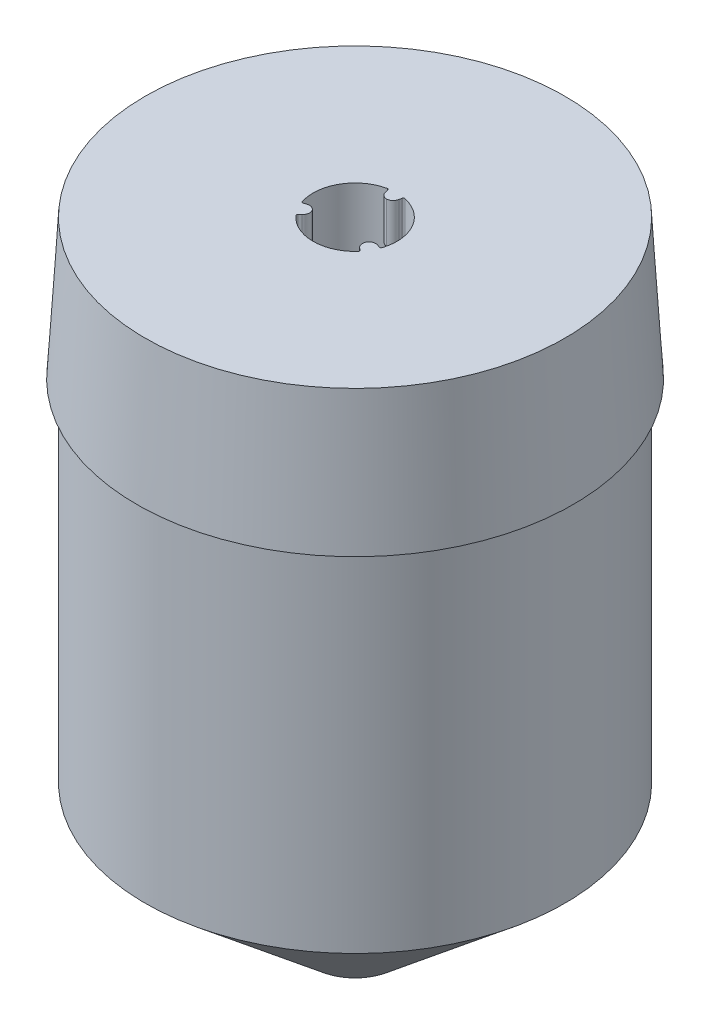
from build123d import *

# Parameters (mm, degrees)
SKETCH1_W           = 8.8
SKETCH1_H           = 32.5
BOSS_EXTRUDE1_START = -3
BOSS_EXTRUDE1_DEPTH = 3
BOSS_EXTRUDE2_START = -3
BOSS_EXTRUDE2_DEPTH = 3
FILLET1_R           = 0.5
FILLET2_R           = 0.1


with BuildPart() as part:
    # Sketch1 → Revolve1 (revolve)
    with BuildSketch(Plane.XY):
        Polygon((-3, 0), (-15, 10), (-15, 35), (-15.6, 35), (-15, 45), (-3, 45), align=None)
        with Locations((-9, 27.15)):
            Rectangle(SKETCH1_W, SKETCH1_H, mode=Mode.SUBTRACT)
    revolve(axis=Axis((0, 21.494459302, 0), (0, -1, 0)))

    # Sketch2 → Boss-Extrude1 (add)
    with BuildSketch(Plane(origin=(0, 45, 0), x_dir=(1, 0, 0), z_dir=(0, 1, 0)).offset(BOSS_EXTRUDE1_START)):
        with BuildLine():
            Line((-0.4, 2.25), (0.4, 2.25))
            Line((0.4, 2.25), (0.525100004, 2.953687523))
            ThreePointArc((0.525100004, 2.953687523), (0, 3), (-0.525100004, 2.953687523))
            Line((-0.525100004, 2.953687523), (-0.4, 2.25))
        make_face()
        with BuildLine():
            Line((2.148557159, -0.778589838), (2.820518432, -1.022093819))
            ThreePointArc((2.820518432, -1.022093819), (2.598076211, -1.5), (2.295418428, -1.931593705))
            Line((2.295418428, -1.931593705), (1.748557159, -1.471410162))
            Line((1.748557159, -1.471410162), (2.148557159, -0.778589838))
        make_face()
        with BuildLine():
            Line((-1.748557159, -1.471410162), (-2.295418428, -1.931593705))
            ThreePointArc((-2.295418428, -1.931593705), (-2.598076211, -1.5), (-2.820518432, -1.022093819))
            Line((-2.820518432, -1.022093819), (-2.148557159, -0.778589838))
            Line((-2.148557159, -0.778589838), (-1.748557159, -1.471410162))
        make_face()
    extrude(amount=BOSS_EXTRUDE1_DEPTH)

    # Sketch3 → Boss-Extrude2 (add)
    with BuildSketch(Plane(origin=(0, 10.9, 0), x_dir=(1, 0, 0), z_dir=(0, 1, 0)).offset(BOSS_EXTRUDE2_START)):
        with BuildLine():
            Line((-0.4, 2.25), (0.4, 2.25))
            Line((0.4, 2.25), (0.525100004, 2.953687523))
            ThreePointArc((0.525100004, 2.953687523), (0, 3), (-0.525100004, 2.953687523))
            Line((-0.525100004, 2.953687523), (-0.4, 2.25))
        make_face()
        with BuildLine():
            Line((-2.295418428, -1.931593705), (-1.748557159, -1.471410162))
            Line((-1.748557159, -1.471410162), (-2.148557159, -0.778589838))
            Line((-2.148557159, -0.778589838), (-2.820518432, -1.022093819))
            ThreePointArc((-2.820518432, -1.022093819), (-2.598076211, -1.5), (-2.295418428, -1.931593705))
        make_face()
        with BuildLine():
            Line((1.748557159, -1.471410162), (2.295418428, -1.931593705))
            ThreePointArc((2.295418428, -1.931593705), (2.598076211, -1.5), (2.820518432, -1.022093819))
            Line((2.820518432, -1.022093819), (2.148557159, -0.778589838))
            Line((2.148557159, -0.778589838), (1.748557159, -1.471410162))
        make_face()
    extrude(amount=BOSS_EXTRUDE2_DEPTH)

    # Fillet1
    # the kernel refuses this fillet: 0.5 mm, written as the material it takes off along each edge
    with BuildSketch(Plane(origin=(-1.748557159, 6.852622791, 1.471410162), x_dir=(-0.765139475997562, 0, 0.6438645682674085), z_dir=(0, 1, 0)), Plane(origin=(2.148557159, 6.852622791, 0.778589838), x_dir=(0.9401728107150568, 0, 0.34069793951849825), z_dir=(0, 1, 0)), Plane(origin=(2.148557159, 40.952622791, 0.778589838), x_dir=(0.9401728107150567, 0, 0.34069793951849836), z_dir=(0, 1, 0)), Plane(origin=(-1.748557159, 40.952622791, 1.471410162), x_dir=(-0.7651394759975623, 0, 0.643864568267408), z_dir=(0, 1, 0)), Plane(origin=(-0.4, 6.852622791, -2.25), x_dir=(-0.17503333471749488, 0, -0.9845625077859066), z_dir=(0, 1, 0)), Plane(origin=(-0.4, 40.952622791, -2.25), x_dir=(-0.17503333471749435, 0, -0.9845625077859067), z_dir=(0, 1, 0))) as fillet1_piece_1:
        with BuildLine():
            CenterArc((FILLET1_R * 0.837901767291, -FILLET1_R), FILLET1_R, 90, 79.919402012)
            Line((-FILLET1_R * 0.146660740495, -FILLET1_R * 0.824966665283), (0, 0))
            Line((0, 0), (FILLET1_R * 0.837901767291, 0))
        make_face()
    extrude(amount=5.094754418, mode=Mode.SUBTRACT)
    with BuildSketch(Plane(origin=(1.748557159, 6.852622791, 1.471410162), x_dir=(0.7651394759975613, 0, 0.6438645682674092), z_dir=(0, 1, 0)), Plane(origin=(-2.148557159, 6.852622791, 0.778589838), x_dir=(-0.9401728107150565, 0, 0.34069793951849886), z_dir=(0, 1, 0)), Plane(origin=(-2.148557159, 40.952622791, 0.778589838), x_dir=(-0.9401728107150564, 0, 0.3406979395184987), z_dir=(0, 1, 0)), Plane(origin=(1.748557159, 40.952622791, 1.471410162), x_dir=(0.7651394759975626, 0, 0.6438645682674077), z_dir=(0, 1, 0)), Plane(origin=(0.4, 6.852622791, -2.25), x_dir=(0.1750333347174944, 0, -0.9845625077859067), z_dir=(0, 1, 0)), Plane(origin=(0.4, 40.952622791, -2.25), x_dir=(0.1750333347174944, 0, -0.9845625077859067), z_dir=(0, 1, 0))) as fillet1_piece_2:
        with BuildLine():
            CenterArc((FILLET1_R * 0.837901767291, FILLET1_R), FILLET1_R, 190.080597988, 79.919402012)
            Line((-FILLET1_R * 0.146660740495, FILLET1_R * 0.824966665283), (0, 0))
            Line((0, 0), (FILLET1_R * 0.837901767291, 0))
        make_face()
    extrude(amount=5.094754418, mode=Mode.SUBTRACT)

    # Fillet2
    fillet2_edges = [part.edges().sort_by_distance(p)[0] for p in [
        (0.525100004, 43.5, -2.953687523),
        (-0.525100004, 43.5, -2.953687523),
        (2.295418428, 43.5, 1.931593705),
        (2.820518432, 43.5, 1.022093819),
        (-2.820518432, 43.5, 1.022093819),
        (-2.295418428, 43.5, 1.931593705),
        (-2.820518432, 9.4, 1.022093819),
        (-2.295418428, 9.4, 1.931593705),
        (2.820518432, 9.4, 1.022093819),
        (2.295418428, 9.4, 1.931593705),
        (0.525100004, 9.4, -2.953687523),
        (-0.525100004, 9.4, -2.953687523),
        (0, 42, -3),
        (-0.499215187, 42, -2.808085428),
        (-0.30937995, 42, -2.372907354),
        (0.30937995, 42, -2.372907354),
        (0.499215187, 42, -2.808085428),
        (2.182265723, 42, 1.836375748),
        (2.598076211, 42, 1.5),
        (2.68148091, 42, 0.97170968),
        (2.209688024, 42, 0.918522781),
        (1.900308074, 42, 1.454384573),
        (-2.598076211, 42, 1.5),
        (-2.182265723, 42, 1.836375748),
        (-1.900308074, 42, 1.454384573),
        (-2.209688024, 42, 0.918522781),
        (-2.68148091, 42, 0.97170968),
        (2.598076211, 7.9, 1.5),
        (2.68148091, 7.9, 0.97170968),
        (2.209688024, 7.9, 0.918522781),
        (1.900308074, 7.9, 1.454384573),
        (2.182265723, 7.9, 1.836375748),
        (-2.598076211, 10.9, 1.5),
        (-2.68148091, 10.9, 0.97170968),
        (-2.209688024, 10.9, 0.918522781),
        (-1.900308074, 10.9, 1.454384573),
        (-2.182265723, 10.9, 1.836375748),
        (2.68148091, 10.9, 0.97170968),
        (2.598076211, 10.9, 1.5),
        (2.182265723, 10.9, 1.836375748),
        (1.900308074, 10.9, 1.454384573),
        (2.209688024, 10.9, 0.918522781),
        (-0.499215187, 10.9, -2.808085428),
        (0, 10.9, -3),
        (0.499215187, 10.9, -2.808085428),
        (0.30937995, 10.9, -2.372907354),
        (-0.30937995, 10.9, -2.372907354),
        (0, 7.9, -3),
        (-0.499215187, 7.9, -2.808085428),
        (-0.30937995, 7.9, -2.372907354),
        (0.30937995, 7.9, -2.372907354),
        (0.499215187, 7.9, -2.808085428),
    ]]
    fillet(fillet2_edges, radius=FILLET2_R)


solid = part.part
